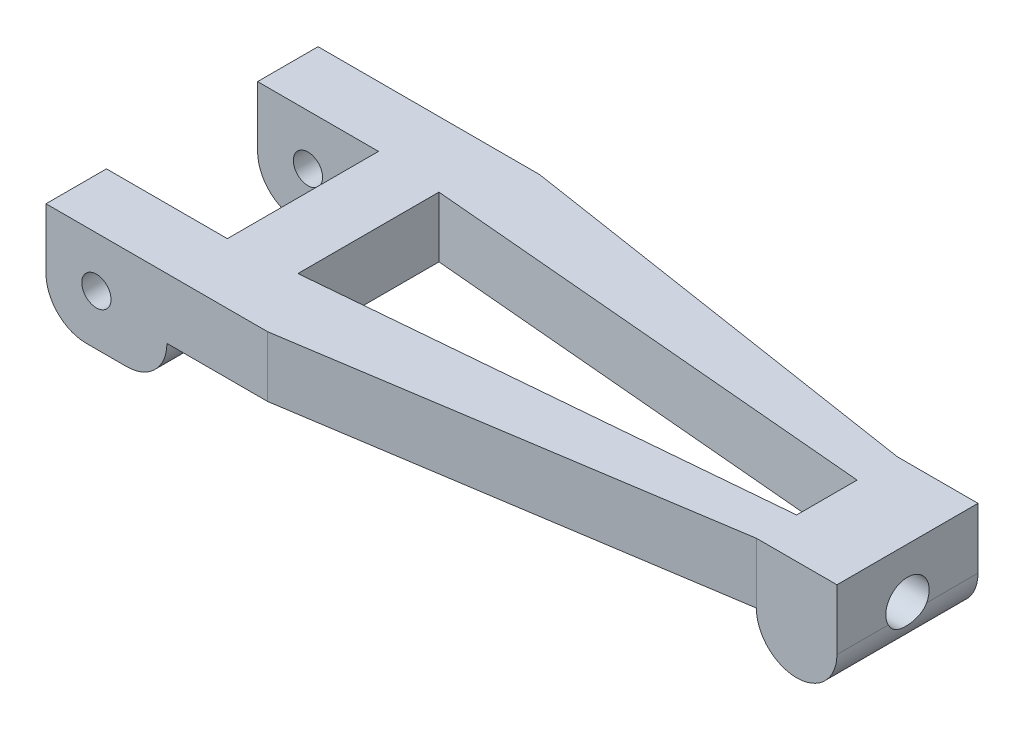
from build123d import *

# Parameters (mm, degrees)
SKETCH1_W           = 72
SKETCH1_H           = 27
BOSS_EXTRUDE1_DEPTH = 6
SKETCH2_W           = 12
SKETCH2_H           = 15
CUT_EXTRUDE1_DEPTH  = 78.129760793
SKETCH3_W           = 8
SKETCH3_H           = 14
BOSS_EXTRUDE2_DEPTH = 4
CUT_EXTRUDE2_DEPTH  = 78.129760793
SKETCH5_W           = 12
SKETCH5_H           = 6
BOSS_EXTRUDE3_DEPTH = 4
CUT_EXTRUDE4_DEPTH  = 78.129760793
SKETCH8_R           = 2.15
CUT_EXTRUDE5_DEPTH  = 10
SKETCH9_R           = 1.45
CUT_EXTRUDE6_DEPTH  = 78.129760793
FILLET2_R           = 4


with BuildPart() as part:
    # Sketch1 → Boss-Extrude1 (new body)
    with BuildSketch(Plane(origin=(0, 0, 0), x_dir=(1, 0, 0), z_dir=(0, 1, 0))):
        with Locations((36, -13.5)):
            Rectangle(SKETCH1_W, SKETCH1_H)
    extrude(amount=BOSS_EXTRUDE1_DEPTH)

    # Sketch2 → Cut-Extrude1 (cut, through all)
    with BuildSketch(Plane(origin=(0, 6, 0), x_dir=(1, 0, 0), z_dir=(0, 1, 0))):
        with Locations((6, -13.5)):
            Rectangle(SKETCH2_W, SKETCH2_H)
    extrude(amount=-CUT_EXTRUDE1_DEPTH, mode=Mode.SUBTRACT)

    # Sketch3 → Boss-Extrude2 (add)
    with BuildSketch(Plane(origin=(0, 0, 0), x_dir=(-1, 0, 0), z_dir=(0, -1, 0))):
        with Locations((-68, -13.5)):
            Rectangle(SKETCH3_W, SKETCH3_H)
    extrude(amount=BOSS_EXTRUDE2_DEPTH)

    # Sketch4 → Cut-Extrude2 (cut, through all)
    with BuildSketch(Plane(origin=(0, 0, 0), x_dir=(-1, 0, 0), z_dir=(0, -1, 0))):
        Polygon((-64, -20.5), (-22, -27), (-72, -27), (-72, -20.5), align=None)
        Polygon((-64, -6.5), (-22, 0), (-72, 0), (-72, -6.5), align=None)
    extrude(amount=-CUT_EXTRUDE2_DEPTH, mode=Mode.SUBTRACT)

    # Sketch5 → Boss-Extrude3 (add)
    with BuildSketch(Plane.XZ):
        with Locations((6, 3)):
            Rectangle(SKETCH5_W, SKETCH5_H)
        with Locations((6, 24)):
            Rectangle(SKETCH5_W, SKETCH5_H)
    extrude(amount=BOSS_EXTRUDE3_DEPTH)

    # Sketch7 → Cut-Extrude4 (cut, through all)
    with BuildSketch(Plane(origin=(0, 0, 0), x_dir=(-1, 0, 0), z_dir=(0, -1, 0))):
        Polygon((-18.5, -20.5), (-18.5, -6.5), (-64, -10.5), (-64, -16.5), align=None)
    extrude(amount=-CUT_EXTRUDE4_DEPTH, mode=Mode.SUBTRACT)

    # Sketch8 → Cut-Extrude5 (cut)
    with BuildSketch(Plane(origin=(72, 0, 0), x_dir=(0, 0, -1), z_dir=(1, 0, 0))):
        with Locations((-13.5, 1)):
            Circle(SKETCH8_R)
    extrude(amount=-CUT_EXTRUDE5_DEPTH, mode=Mode.SUBTRACT)

    # Sketch9 → Cut-Extrude6 (cut, through all)
    with BuildSketch(Plane(origin=(0, 0, 0), x_dir=(-1, 0, 0), z_dir=(0, 0, -1))):
        with Locations((-5, 1)):
            Circle(SKETCH9_R)
    extrude(amount=-CUT_EXTRUDE6_DEPTH, mode=Mode.SUBTRACT)

    # Fillet2
    # the kernel refuses this fillet: 4 mm, written as the material it takes off along each edge
    with BuildSketch(Plane(origin=(0, -4, 11), x_dir=(0, 1, 0), z_dir=(0, 0, 1)), Plane(origin=(0, -4, 16), x_dir=(1, 0, 0), z_dir=(0, 0, -1)), Plane(origin=(12, -4, 37), x_dir=(0, 1, 0), z_dir=(0, 0, -1))) as fillet2_piece_1:
        with BuildLine():
            CenterArc((FILLET2_R, -FILLET2_R), FILLET2_R, 90, 90)
            Line((0, -FILLET2_R), (0, 0))
            Line((0, 0), (FILLET2_R, 0))
        make_face()
    extrude(amount=26, mode=Mode.SUBTRACT)
    with BuildSketch(Plane(origin=(12, -4, -10), x_dir=(0, 1, 0), z_dir=(0, 0, 1))) as fillet2_piece_2:
        with BuildLine():
            CenterArc((FILLET2_R, FILLET2_R), FILLET2_R, 180, 90)
            Line((0, FILLET2_R), (0, 0))
            Line((0, 0), (FILLET2_R, 0))
        make_face()
    extrude(amount=26, mode=Mode.SUBTRACT)
    with BuildSketch(Plane(origin=(72, -4, -3.5), x_dir=(0, 1, 0), z_dir=(0, 0, 1)), Plane(origin=(64, -4, 30.5), x_dir=(0, 1, 0), z_dir=(0, 0, -1))) as fillet2_piece_3:
        with BuildLine():
            CenterArc((FILLET2_R, FILLET2_R), FILLET2_R, 180, 90)
            Line((0, FILLET2_R), (0, 0))
            Line((0, 0), (FILLET2_R, 0))
        make_face()
    extrude(amount=34, mode=Mode.SUBTRACT)


solid = part.part
